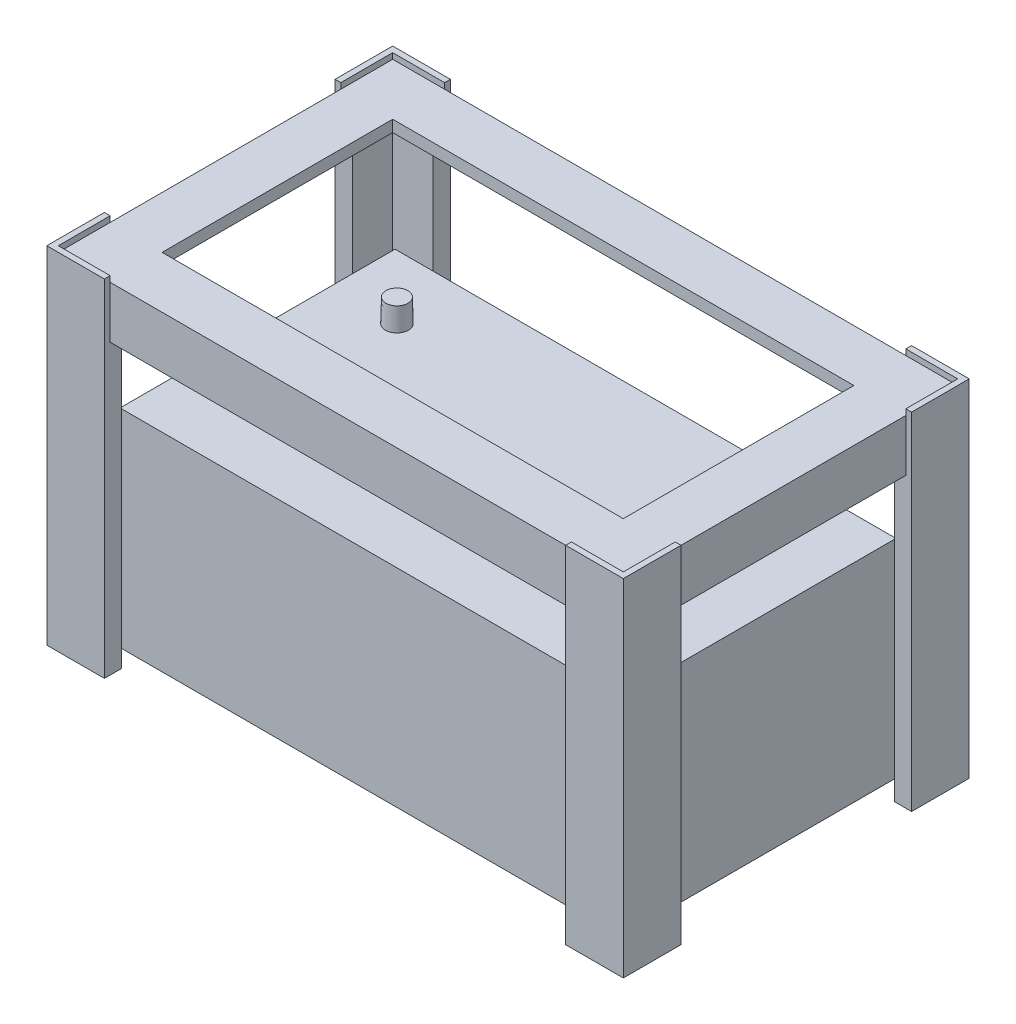
from build123d import *
from OCP.BRepFilletAPI import BRepFilletAPI_MakeChamfer

# Parameters (mm, degrees)
SALIENTE_EXTRUIR1_DEPTH  = 1.5
SALIENTE_EXTRUIR2_DEPTH  = 3.5
CROQUIS3_W               = 25
CROQUIS3_H               = 5
SALIENTE_EXTRUIR3_DEPTH  = 1.5
CROQUIS4_W               = 25
CROQUIS4_H               = 1.5
SALIENTE_EXTRUIR4_DEPTH  = 3.5
CROQUIS5_W               = 5
CROQUIS5_H               = 25
SALIENTE_EXTRUIR5_DEPTH  = 1.5
CROQUIS6_W               = 1.5
CROQUIS6_H               = 28.5
SALIENTE_EXTRUIR6_DEPTH  = 3.5
SALIENTE_EXTRUIR7_DEPTH  = 1.5
SALIENTE_EXTRUIR9_DEPTH  = 3.5
SALIENTE_EXTRUIR10_REACH = 63.847
CROQUIS10_W              = 40
CROQUIS10_H              = 5
CORTAR_EXTRUIR1_DEPTH    = 0.5
CROQUIS11_W              = 5
CROQUIS11_H              = 20
CROQUIS11_W_2            = 40
CROQUIS11_H_2            = 4.5
CROQUIS11_H_3            = 5
CORTAR_EXTRUIR2_DEPTH    = 0.5
CROQUIS12_W              = 40
CROQUIS12_H              = 4.5
CORTAR_EXTRUIR3_DEPTH    = 0.5
CROQUIS13_W              = 20
CROQUIS13_H              = 4.5
CORTAR_EXTRUIR4_DEPTH    = 0.5
CROQUIS14_W              = 20
CROQUIS14_H              = 4.5
CORTAR_EXTRUIR5_DEPTH    = 0.5
CROQUIS16_W              = 4.5
CROQUIS16_H              = 4.5
CORTAR_EXTRUIR8_DEPTH    = 0.5
CROQUIS17_W              = 43.445704927
CROQUIS17_H              = 23.849273722
SALIENTE_EXTRUIR11_DEPTH = 18
CROQUIS19_R              = 1
SALIENTE_EXTRUIR12_DEPTH = 2
CHAFL_N1_SIZE            = 2
CHAFL_N1_SIZE_2          = 0.05


with BuildPart() as part:
    # Croquis1 → Saliente-Extruir1 (new body)
    with BuildSketch(Plane.XY):
        Polygon((0, 30), (0, 0), (5, 0), (5, 25), (45, 25), (45, 0), (50, 0), (50, 30), (5, 30), align=None)
    extrude(amount=SALIENTE_EXTRUIR1_DEPTH)

    # Croquis2 → Saliente-Extruir2 (add)
    with BuildSketch(Plane.XY.offset(1.5)):
        Polygon((0, 0), (1.5, 0), (1.5, 28.5), (48.5, 28.5), (48.5, 0), (50, 0), (50, 28.5), (50, 30), (48.5, 30), (0, 30), align=None)
    extrude(amount=SALIENTE_EXTRUIR2_DEPTH)

    # Croquis3 → Saliente-Extruir3 (add)
    with BuildSketch(Plane.ZY):
        with Locations((17.5, 27.5)):
            Rectangle(CROQUIS3_W, CROQUIS3_H)
    extrude(amount=-SALIENTE_EXTRUIR3_DEPTH)

    # Croquis4 → Saliente-Extruir4 (add)
    with BuildSketch(Plane(origin=(1.5, 0, 0), x_dir=(0, 0, -1), z_dir=(1, 0, 0))):
        with Locations((-17.5, 29.25)):
            Rectangle(CROQUIS4_W, CROQUIS4_H)
    extrude(amount=SALIENTE_EXTRUIR4_DEPTH)

    # Croquis5 → Saliente-Extruir5 (add)
    with BuildSketch(Plane.ZY):
        with Locations((27.5, 12.5)):
            Rectangle(CROQUIS5_W, CROQUIS5_H)
    extrude(amount=-SALIENTE_EXTRUIR5_DEPTH)

    # Croquis6 → Saliente-Extruir6 (add)
    with BuildSketch(Plane(origin=(1.5, 0, 0), x_dir=(0, 0, -1), z_dir=(1, 0, 0))):
        with Locations((-29.25, 14.25)):
            Rectangle(CROQUIS6_W, CROQUIS6_H)
    extrude(amount=SALIENTE_EXTRUIR6_DEPTH)

    # Croquis7 → Saliente-Extruir7 (add)
    with BuildSketch(Plane(origin=(50, 0, 0), x_dir=(0, 0, -1), z_dir=(1, 0, 0))):
        Polygon((-5, 30), (-30, 30), (-30, 0), (-25, 0), (-25, 25), (-5, 25), align=None)
    extrude(amount=-SALIENTE_EXTRUIR7_DEPTH)

    # Croquis8 → Saliente-Extruir9 (add)
    with BuildSketch(Plane.ZY.offset(-48.5)):
        Polygon((5, 28.5), (25, 28.5), (28.5, 28.5), (28.5, 0), (30, 0), (30, 30), (5, 30), align=None)
    extrude(amount=SALIENTE_EXTRUIR9_DEPTH)

    # Croquis9 → Saliente-Extruir10 (add, up to next)
    with BuildSketch(Plane(origin=(5, 0, 0), x_dir=(0, 0, -1), z_dir=(1, 0, 0)), mode=Mode.PRIVATE) as saliente_extruir10_sk1:
        Polygon((-28.5, 25), (-30, 25), (-30, 30), (-25, 30), (-25, 28.5), (-28.5, 28.5), align=None)
    saliente_extruir10_tool1 = extrude(saliente_extruir10_sk1.sketch, amount=SALIENTE_EXTRUIR10_REACH, mode=Mode.PRIVATE) - part.part
    add(saliente_extruir10_tool1.solids().sort_by_distance((5, 25.070711, 29.25))[0])

    # Croquis10 → Cortar-Extruir1 (cut)
    with BuildSketch(Plane(origin=(0, 0, 0), x_dir=(-1, 0, 0), z_dir=(0, 0, -1))):
        with Locations((-25, 27.5)):
            Rectangle(CROQUIS10_W, CROQUIS10_H)
    extrude(amount=-CORTAR_EXTRUIR1_DEPTH, mode=Mode.SUBTRACT)

    # Croquis11 → Cortar-Extruir2 (cut)
    with BuildSketch(Plane(origin=(0, 30, 0), x_dir=(1, 0, 0), z_dir=(0, 1, 0))):
        with Locations((2.5, -15)):
            Rectangle(CROQUIS11_W, CROQUIS11_H)
        with Locations((25, -2.75)):
            Rectangle(CROQUIS11_W_2, CROQUIS11_H_2)
        with Locations((25, -27.5)):
            Rectangle(CROQUIS11_W_2, CROQUIS11_H_3)
        with Locations((47.5, -15)):
            Rectangle(CROQUIS11_W, CROQUIS11_H)
    extrude(amount=-CORTAR_EXTRUIR2_DEPTH, mode=Mode.SUBTRACT)

    # Croquis12 → Cortar-Extruir3 (cut)
    with BuildSketch(Plane.XY.offset(30)):
        with Locations((25, 27.25)):
            Rectangle(CROQUIS12_W, CROQUIS12_H)
    extrude(amount=-CORTAR_EXTRUIR3_DEPTH, mode=Mode.SUBTRACT)

    # Croquis13 → Cortar-Extruir4 (cut)
    with BuildSketch(Plane(origin=(50, 0, 0), x_dir=(0, 0, -1), z_dir=(1, 0, 0))):
        with Locations((-15, 27.25)):
            Rectangle(CROQUIS13_W, CROQUIS13_H)
    extrude(amount=-CORTAR_EXTRUIR4_DEPTH, mode=Mode.SUBTRACT)

    # Croquis14 → Cortar-Extruir5 (cut)
    with BuildSketch(Plane.ZY):
        with Locations((15, 27.25)):
            Rectangle(CROQUIS14_W, CROQUIS14_H)
    extrude(amount=-CORTAR_EXTRUIR5_DEPTH, mode=Mode.SUBTRACT)

    # Croquis16 → Cortar-Extruir8 (cut)
    with BuildSketch(Plane(origin=(0, 30, 0), x_dir=(1, 0, 0), z_dir=(0, 1, 0))):
        with Locations((2.75, -2.75)):
            Rectangle(CROQUIS16_W, CROQUIS16_H)
        with Locations((47.25, -2.75)):
            Rectangle(CROQUIS16_W, CROQUIS16_H)
        with Locations((47.25, -27.25)):
            Rectangle(CROQUIS16_W, CROQUIS16_H)
        with Locations((2.75, -27.25)):
            Rectangle(CROQUIS16_W, CROQUIS16_H)
    extrude(amount=-CORTAR_EXTRUIR8_DEPTH, mode=Mode.SUBTRACT)


with BuildPart() as body_2:
    # Croquis17 → Saliente-Extruir11 (new body)
    with BuildSketch(Plane(origin=(0, 0, 0), x_dir=(1, 0, 0), z_dir=(0, 1, 0))):
        with Locations((25.083389069, -15.083389069)):
            Rectangle(CROQUIS17_W, CROQUIS17_H)
    extrude(amount=SALIENTE_EXTRUIR11_DEPTH)

    # Croquis19 → Saliente-Extruir12 (add)
    with BuildSketch(Plane(origin=(0, 18, 0), x_dir=(1, 0, 0), z_dir=(0, 1, 0))):
        with Locations(Location((9.030993295, -8.662430759, 0), (0, 0, 270))):
            Circle(CROQUIS19_R)
        with Locations(Location((40.802228568, -23.422295965, 0), (0, 0, 270))):
            Circle(CROQUIS19_R)
    extrude(amount=SALIENTE_EXTRUIR12_DEPTH)

    # Chaflán1
    chafl_n1_edges_1 = [body_2.edges().sort_by_distance(p)[0] for p in [
        (9.030993295, 20, 7.662430759),
    ]]
    chafl_n1_side_1 = [body_2.faces().sort_by_distance(p)[0] for p in [
        (9.030993295, 19.999, 7.662430759),
    ]]
    chafl_n1_edges_2 = [body_2.edges().sort_by_distance(p)[0] for p in [
        (40.802228568, 20, 22.422295965),
    ]]
    chafl_n1_side_2 = [body_2.faces().sort_by_distance(p)[0] for p in [
        (40.802228568, 19.999, 22.422295965),
    ]]
    chafl_n1 = BRepFilletAPI_MakeChamfer(body_2.part.solid().wrapped)
    for e in chafl_n1_edges_1:
        chafl_n1.Add(CHAFL_N1_SIZE - 0.0001, CHAFL_N1_SIZE_2 - 0.0001, e.wrapped, chafl_n1_side_1[0].wrapped)
    for e in chafl_n1_edges_2:
        chafl_n1.Add(CHAFL_N1_SIZE - 0.0001, CHAFL_N1_SIZE_2 - 0.0001, e.wrapped, chafl_n1_side_2[0].wrapped)
    add(Compound.cast(chafl_n1.Shape()), mode=Mode.REPLACE)  # a hair under: the kernel refuses the full size


solid = Compound([part.part, body_2.part])
